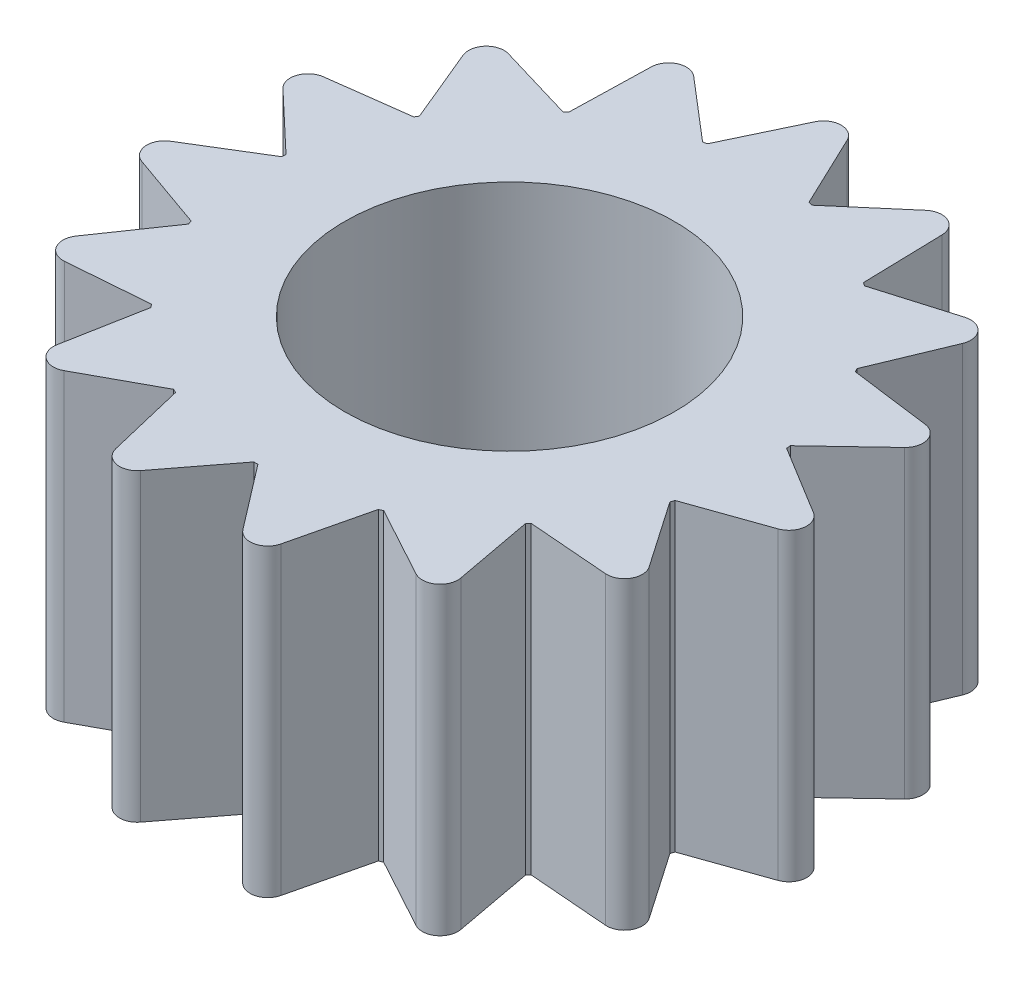
from build123d import *

# Parameters (mm, degrees)
SKETCH1_R           = 3.25
BOSS_EXTRUDE2_DEPTH = 6
FILLET1_R           = 0.35


with BuildPart() as part:
    # Sketch1 → Boss-Extrude2 (new body)
    with BuildSketch(Plane(origin=(0, 0, 0), x_dir=(1, 0, 0), z_dir=(0, 1, 0))):
        with BuildLine():
            Line((0, 7), (-1, 4.898979486))
            ThreePointArc((-1, 4.898979486), (-1.039558454, 4.890738004), (-1.079049013, 4.882177099))
            Line((-1.079049013, 4.882177099), (-2.847156502, 6.394818203))
            Line((-2.847156502, 6.394818203), (-2.906139928, 4.068703813))
            ThreePointArc((-2.906139928, 4.068703813), (-2.938926261, 4.045084972), (-2.971520648, 4.021201939))
            Line((-2.971520648, 4.021201939), (-5.202013778, 4.683914245))
            Line((-5.202013778, 4.683914245), (-4.309781861, 2.534912288))
            ThreePointArc((-4.309781861, 2.534912288), (-4.330127019, 2.5), (-4.350189369, 2.464924432))
            Line((-4.350189369, 2.464924432), (-6.657395614, 2.163118961))
            Line((-6.657395614, 2.163118961), (-4.968223357, 0.5628114))
            ThreePointArc((-4.968223357, 0.5628114), (-4.972609477, 0.522642316), (-4.976670827, 0.482439098))
            Line((-4.976670827, 0.482439098), (-6.961653268, -0.731699243))
            Line((-6.961653268, -0.731699243), (-4.7676139, -1.506604693))
            ThreePointArc((-4.7676139, -1.506604693), (-4.755282581, -1.545084972), (-4.742640687, -1.583464339))
            Line((-4.742640687, -1.583464339), (-6.062177826, -3.5))
            Line((-6.062177826, -3.5), (-3.742640687, -3.315515147))
            ThreePointArc((-3.742640687, -3.315515147), (-3.715724127, -3.345653032), (-3.688564887, -3.375572407))
            Line((-3.688564887, -3.375572407), (-4.114496766, -5.663118961))
            Line((-4.114496766, -5.663118961), (-2.070530899, -4.551142911))
            ThreePointArc((-2.070530899, -4.551142911), (-2.033683215, -4.567727288), (-1.996702709, -4.584013339))
            Line((-1.996702709, -4.584013339), (-1.455381836, -6.847033205))
            Line((-1.455381836, -6.847033205), (-0.040407507, -4.999836721))
            ThreePointArc((-0.040407507, -4.999836721), (0, -5), (0.040407507, -4.999836721))
            Line((0.040407507, -4.999836721), (1.455381836, -6.847033205))
            Line((1.455381836, -6.847033205), (1.996702709, -4.584013339))
            ThreePointArc((1.996702709, -4.584013339), (2.033683215, -4.567727288), (2.070530899, -4.551142911))
            Line((2.070530899, -4.551142911), (4.114496766, -5.663118961))
            Line((4.114496766, -5.663118961), (3.688564887, -3.375572407))
            ThreePointArc((3.688564887, -3.375572407), (3.715724127, -3.345653032), (3.742640687, -3.315515147))
            Line((3.742640687, -3.315515147), (6.062177826, -3.5))
            Line((6.062177826, -3.5), (4.742640687, -1.583464339))
            ThreePointArc((4.742640687, -1.583464339), (4.755282581, -1.545084972), (4.7676139, -1.506604693))
            Line((4.7676139, -1.506604693), (6.961653268, -0.731699243))
            Line((6.961653268, -0.731699243), (4.976670827, 0.482439098))
            ThreePointArc((4.976670827, 0.482439098), (4.972609477, 0.522642316), (4.968223357, 0.5628114))
            Line((4.968223357, 0.5628114), (6.657395614, 2.163118961))
            Line((6.657395614, 2.163118961), (4.350189369, 2.464924432))
            ThreePointArc((4.350189369, 2.464924432), (4.330127019, 2.5), (4.309781861, 2.534912288))
            Line((4.309781861, 2.534912288), (5.202013778, 4.683914245))
            Line((5.202013778, 4.683914245), (2.971520648, 4.021201939))
            ThreePointArc((2.971520648, 4.021201939), (2.938926261, 4.045084972), (2.906139928, 4.068703813))
            Line((2.906139928, 4.068703813), (2.847156502, 6.394818203))
            Line((2.847156502, 6.394818203), (1.079049013, 4.882177099))
            ThreePointArc((1.079049013, 4.882177099), (1.039558454, 4.890738004), (1, 4.898979486))
            Line((1, 4.898979486), (0, 7))
        make_face()
        Circle(SKETCH1_R, mode=Mode.SUBTRACT)
    extrude(amount=BOSS_EXTRUDE2_DEPTH)

    # Fillet1
    fillet1_edges = [part.edges().sort_by_distance(p)[0] for p in [
        (0, 3, -7),
        (2.847156502, 3, -6.394818203),
        (5.202013778, 3, -4.683914245),
        (6.657395614, 3, -2.163118961),
        (6.961653268, 3, 0.731699243),
        (6.062177826, 3, 3.5),
        (4.114496766, 3, 5.663118961),
        (1.455381836, 3, 6.847033205),
        (-1.455381836, 3, 6.847033205),
        (-4.114496766, 3, 5.663118961),
        (-6.062177826, 3, 3.5),
        (-6.961653268, 3, 0.731699243),
        (-2.847156502, 3, -6.394818203),
        (-5.202013778, 3, -4.683914245),
        (-6.657395614, 3, -2.163118961),
    ]]
    fillet(fillet1_edges, radius=FILLET1_R)


solid = part.part
